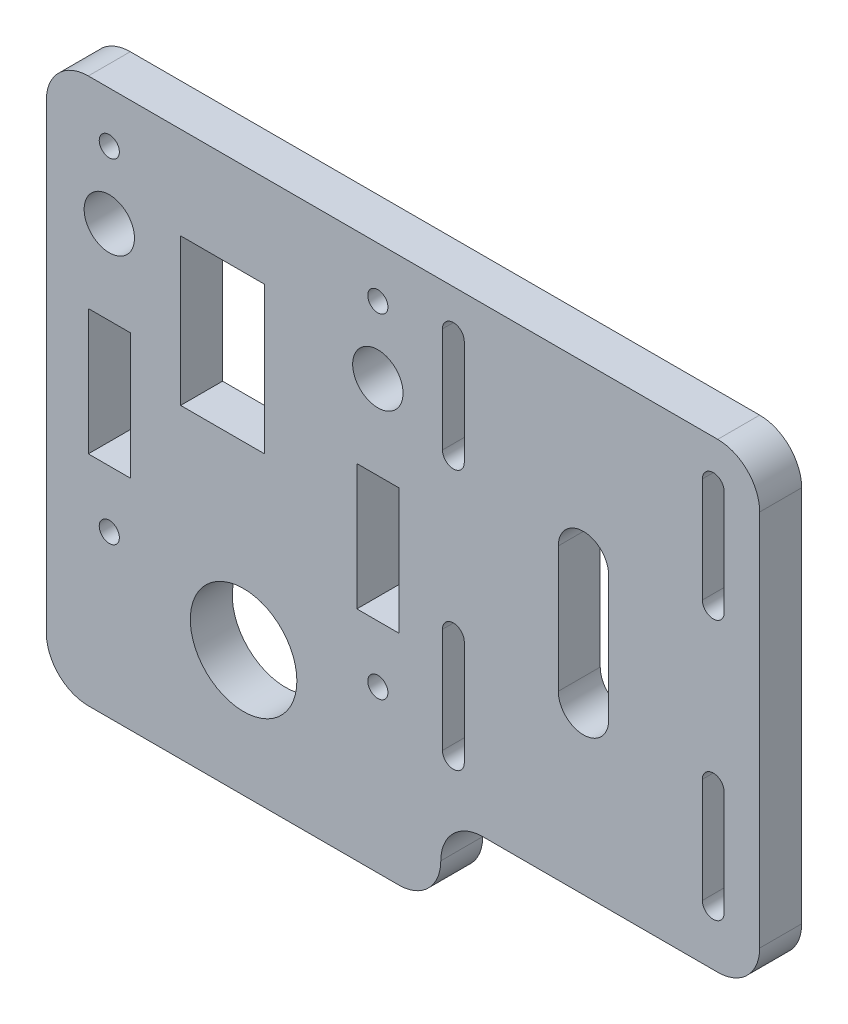
from build123d import *

# Parameters (mm, degrees)
SKETCH1_R           = 3
SKETCH1_R_2         = 1.2
SKETCH1_R_3         = 6.35
SKETCH1_W           = 5
SKETCH1_H           = 15
SKETCH1_W_2         = 10
SKETCH1_H_2         = 17.5
BOSS_EXTRUDE1_DEPTH = 5
SKETCH2_W           = 38
SKETCH2_H           = 55
BOSS_EXTRUDE2_DEPTH = 5
FILLET1_R           = 5


with BuildPart() as part:
    # Sketch1 → Boss-Extrude1 (new body)
    with BuildSketch(Plane.XY):
        Polygon((-23.5, 65), (23.5, 65), (23.5, 0), (0, 0), (-23.5, 0), align=None)
        with Locations((16, 51)):
            Circle(SKETCH1_R, mode=Mode.SUBTRACT)
        with Locations((16, 19.2)):
            Circle(SKETCH1_R_2, mode=Mode.SUBTRACT)
        with Locations((16, 59)):
            Circle(SKETCH1_R_2, mode=Mode.SUBTRACT)
        with Locations(Location((-16, 59, 0), (0, 0, 180))):
            Circle(SKETCH1_R_2, mode=Mode.SUBTRACT)
        with Locations(Location((-16, 19.2, 0), (0, 0, 180))):
            Circle(SKETCH1_R_2, mode=Mode.SUBTRACT)
        with Locations(Location((-16, 51, 0), (0, 0, 180))):
            Circle(SKETCH1_R, mode=Mode.SUBTRACT)
        with Locations((0, 15)):
            Circle(SKETCH1_R_3, mode=Mode.SUBTRACT)
        with Locations((16, 33.5)):
            Rectangle(SKETCH1_W, SKETCH1_H, mode=Mode.SUBTRACT)
        with Locations((-2.5, 45.25)):
            Rectangle(SKETCH1_W_2, SKETCH1_H_2, mode=Mode.SUBTRACT)
        with Locations((-16, 33.5)):
            Rectangle(SKETCH1_W, SKETCH1_H, mode=Mode.SUBTRACT)
    extrude(amount=BOSS_EXTRUDE1_DEPTH)

    # Sketch2 → Boss-Extrude2 (add)
    with BuildSketch(Plane(origin=(0, 0, 0), x_dir=(-1, 0, 0), z_dir=(0, 0, -1))):
        with Locations((-42.5, 37.5)):
            Rectangle(SKETCH2_W, SKETCH2_H)
        with BuildLine():
            Line((-37.5, 44.5), (-37.5, 29.5))
            ThreePointArc((-37.5, 29.5), (-40.5, 26.5), (-43.5, 29.5))
            Line((-43.5, 29.5), (-43.5, 44.5))
            ThreePointArc((-43.5, 44.5), (-40.5, 47.5), (-37.5, 44.5))
        make_face(mode=Mode.SUBTRACT)
        with BuildLine():
            Line((-23.7, 60), (-23.7, 47.5))
            ThreePointArc((-23.7, 47.5), (-25, 46.2), (-26.3, 47.5))
            Line((-26.3, 47.5), (-26.3, 60))
            ThreePointArc((-26.3, 60), (-25, 61.3), (-23.7, 60))
        make_face(mode=Mode.SUBTRACT)
        with BuildLine():
            Line((-54.668271165, 60), (-54.668271165, 47.5))
            ThreePointArc((-54.668271165, 47.5), (-55.968271165, 46.2), (-57.268271165, 47.5))
            Line((-57.268271165, 47.5), (-57.268271165, 60))
            ThreePointArc((-57.268271165, 60), (-55.968271165, 61.3), (-54.668271165, 60))
        make_face(mode=Mode.SUBTRACT)
        with BuildLine():
            Line((-23.7, 29), (-23.7, 16.5))
            ThreePointArc((-23.7, 16.5), (-25, 15.2), (-26.3, 16.5))
            Line((-26.3, 16.5), (-26.3, 29))
            ThreePointArc((-26.3, 29), (-25, 30.3), (-23.7, 29))
        make_face(mode=Mode.SUBTRACT)
        with BuildLine():
            Line((-54.668271165, 29), (-54.668271165, 16.5))
            ThreePointArc((-54.668271165, 16.5), (-55.968271165, 15.2), (-57.268271165, 16.5))
            Line((-57.268271165, 16.5), (-57.268271165, 29))
            ThreePointArc((-57.268271165, 29), (-55.968271165, 30.3), (-54.668271165, 29))
        make_face(mode=Mode.SUBTRACT)
    extrude(amount=-BOSS_EXTRUDE2_DEPTH)

    # Fillet1
    fillet1_edges = [part.edges().sort_by_distance(p)[0] for p in [
        (23.5, 0, 2.5),
        (-23.5, 0, 2.5),
        (-23.5, 65, 2.5),
        (23.5, 10, 2.5),
        (61.5, 10, 2.5),
        (61.5, 65, 2.5),
    ]]
    fillet(fillet1_edges, radius=FILLET1_R - 0.0001)  # a hair under: the kernel refuses the full size


solid = part.part
